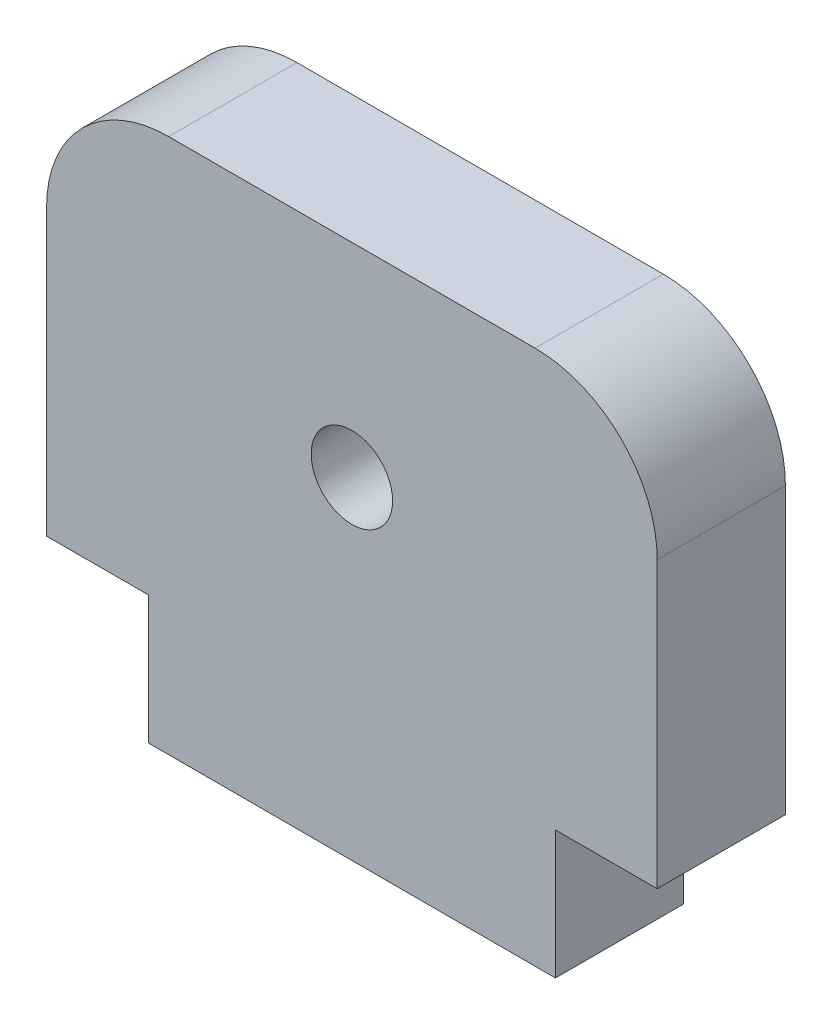
from build123d import *

# Parameters (mm, degrees)
SKETCH2_R           = 1.27
BOSS_EXTRUDE1_DEPTH = 4


with BuildPart() as part:
    # Sketch2 → Boss-Extrude1 (new body)
    with BuildSketch(Plane.XY):
        with BuildLine():
            Line((-9.525, -6.35), (-6.35, -6.35))
            Line((-6.35, -6.35), (-6.35, -10.35))
            Line((-6.35, -10.35), (6.35, -10.35))
            Line((6.35, -10.35), (6.35, -6.35))
            Line((6.35, -6.35), (9.525, -6.35))
            Line((9.525, -6.35), (9.525, 2.54))
            ThreePointArc((9.525, 2.54), (8.409076836, 5.234076836), (5.715, 6.35))
            Line((5.715, 6.35), (-5.715, 6.35))
            ThreePointArc((-5.715, 6.35), (-8.409076836, 5.234076836), (-9.525, 2.54))
            Line((-9.525, 2.54), (-9.525, -6.35))
        make_face()
        Circle(SKETCH2_R, mode=Mode.SUBTRACT)
    extrude(amount=BOSS_EXTRUDE1_DEPTH)


solid = part.part
